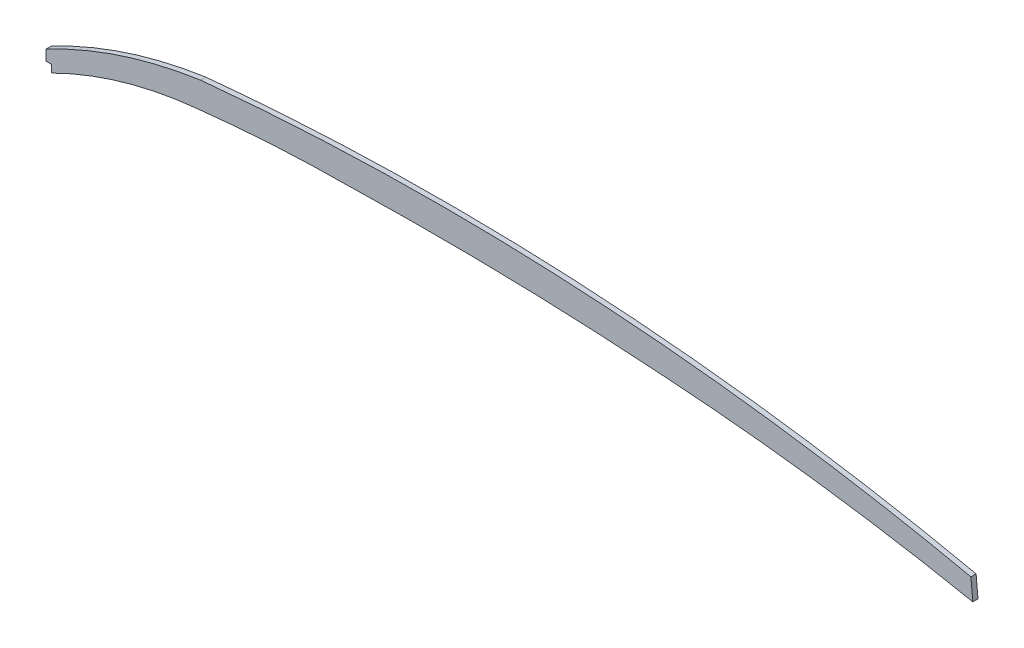
from build123d import *

# Parameters (mm, degrees)
BOSS_EXTRUDE1_DEPTH = 1.5875
SKETCH2_W           = 3.302
SKETCH2_H           = 6.35
CUT_EXTRUDE1_DEPTH  = 583.351295045


with BuildPart() as part:
    # Sketch1 → Boss-Extrude1 (new, symmetric)
    with BuildSketch(Plane.XY):
        with BuildLine():
            Line((0, 98.649963947), (0, 85.942195343))
            ThreePointArc((0, 85.942195343), (44.883725347, 104.075489893), (92.3925, 113.364273632))
            ThreePointArc((92.3925, 113.364273632), (139.073495573, 117.280009783), (185.895946704, 118.731356536))
            ThreePointArc((185.895946704, 118.731356536), (279.546572247, 118.926979108), (373.101055052, 114.680017829))
            ThreePointArc((373.101055052, 114.680017829), (470.024153779, 105.277481614), (566.085246422, 89.316239979))
            Line((566.085246422, 89.316239979), (564.932089986, 101.967188211))
            add(Edge.make_bspline(
                [(564.932089986, 101.967188211), (526.305455218, 110.358765648), (487.405693808, 117.234573225), (438.439550099, 123.934433666), (428.624759847, 125.179975832), (408.998984047, 127.476532586), (399.18472115, 128.528085596), (369.737829992, 131.394153114), (350.101100844, 132.920187183), (291.174630327, 136.352842591), (251.868630305, 137.115735014), (173.213311456, 135.594221207), (133.863993721, 133.309891798), (94.492645692, 129.475822378)],
                knots=[0, 0, 0, 0, 0.25, 0.25, 0.3125, 0.3125, 0.375, 0.375, 0.5, 0.5, 0.75, 0.75, 1, 1, 1, 1], degree=3))
            ThreePointArc((94.492645692, 129.475822378), (45.925545315, 118.111564298), (0, 98.649963947))
        make_face()
    extrude(amount=BOSS_EXTRUDE1_DEPTH, both=True)

    # Sketch2 → Cut-Extrude1 (cut, through all)
    with BuildSketch(Plane.XY.offset(1.5875)):
        with Locations((1.651, 89.117195343)):
            Rectangle(SKETCH2_W, SKETCH2_H)
    extrude(amount=-CUT_EXTRUDE1_DEPTH, mode=Mode.SUBTRACT)


solid = part.part
